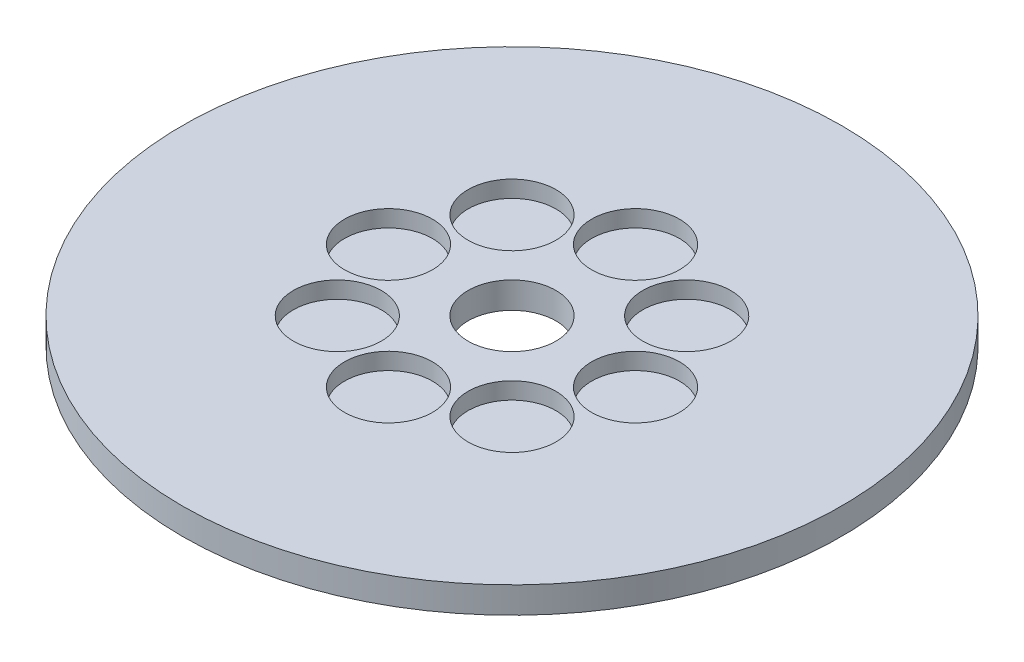
from build123d import *

# Parameters (mm, degrees)
SKETCH1_R           = 75
BOSS_EXTRUDE1_DEPTH = 6
SKETCH2_R           = 10
CUT_EXTRUDE1_DEPTH  = 107.235587258
SKETCH3_R           = 10
CUT_EXTRUDE2_DEPTH  = 3.816787424
CIRPATTERN1_COUNT   = 8


with BuildPart() as part:
    # Sketch1 → Boss-Extrude1 (new body)
    with BuildSketch(Plane(origin=(0, 0, 0), x_dir=(1, 0, 0), z_dir=(0, 1, 0))):
        Circle(SKETCH1_R)
    extrude(amount=BOSS_EXTRUDE1_DEPTH)

    # Sketch2 → Cut-Extrude1 (cut, through all)
    with BuildSketch(Plane(origin=(0, 0, 0), x_dir=(1, 0, 0), z_dir=(0, 1, 0))):
        Circle(SKETCH2_R)
    extrude(amount=CUT_EXTRUDE1_DEPTH, mode=Mode.SUBTRACT)

    # Sketch3 → Cut-Extrude2 (cut)
    with BuildSketch(Plane(origin=(0, 6, 0), x_dir=(1, 0, 0), z_dir=(0, 1, 0))):
        with Locations((-28.111849566, 0)):
            Circle(SKETCH3_R)
    cut_extrude2 = extrude(amount=-CUT_EXTRUDE2_DEPTH, mode=Mode.SUBTRACT)

    # CirPattern1: Cut-Extrude2 ×8 about axis
    cirpattern1_axis = Axis((0, 0, 0), (0, 1, 0))
    for i in range(1, CIRPATTERN1_COUNT):
        add(cut_extrude2.rotate(cirpattern1_axis, i * 360 / CIRPATTERN1_COUNT), mode=Mode.SUBTRACT)


solid = part.part
